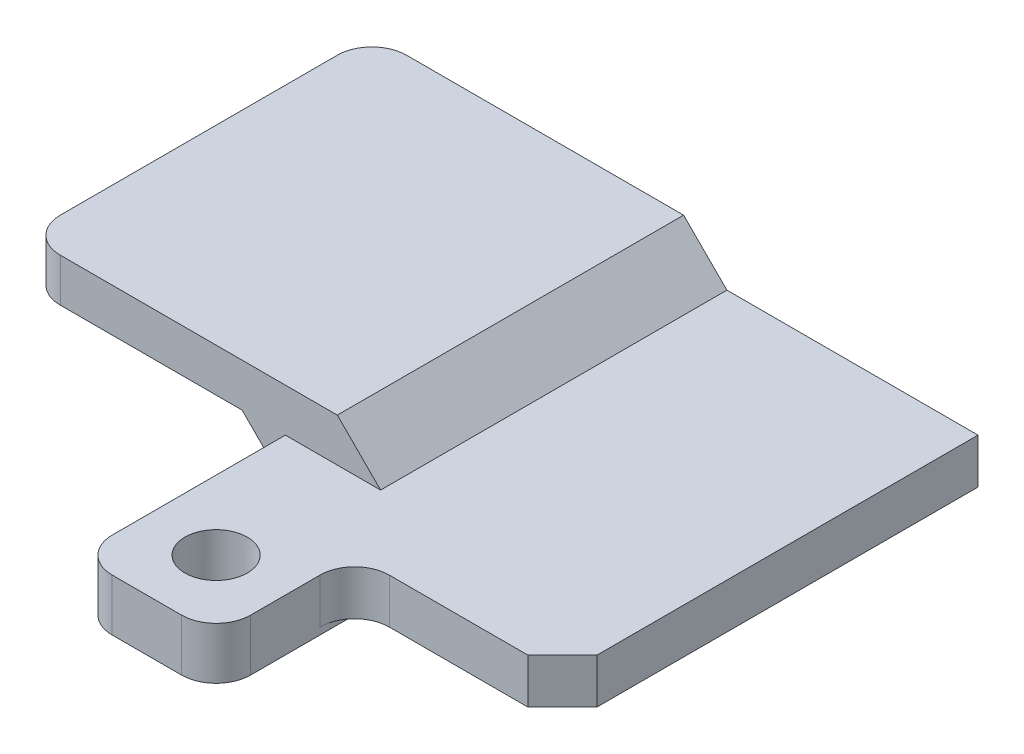
from build123d import *

# Parameters (mm, degrees)
SKETCH1_W           = 20
SKETCH1_H           = 24
BOSS_EXTRUDE1_DEPTH = 3
SKETCH2_W           = 8
SKETCH2_H           = 8
SKETCH2_R           = 1.8
BOSS_EXTRUDE2_DEPTH = 3
FILLET1_R           = 2
CHAMFER1_SIZE       = 2
SKETCH3_W           = 18
SKETCH3_H           = 24
BOSS_EXTRUDE3_DEPTH = 2.5
CHAMFER2_SIZE       = 2.5
CUT_EXTRUDE4_DEPTH  = 4
FILLET2_R           = 2
CUT_EXTRUDE3_DEPTH  = 0.4


with BuildPart() as part:
    # Sketch1 → Boss-Extrude1 (new body)
    with BuildSketch(Plane(origin=(0, 0, 0), x_dir=(1, 0, 0), z_dir=(0, 1, 0))):
        with Locations((10, 12)):
            Rectangle(SKETCH1_W, SKETCH1_H)
    extrude(amount=BOSS_EXTRUDE1_DEPTH)

    # Sketch2 → Boss-Extrude2 (add)
    with BuildSketch(Plane(origin=(0, 3, 0), x_dir=(1, 0, 0), z_dir=(0, 1, 0))):
        with Locations((4, -4)):
            Rectangle(SKETCH2_W, SKETCH2_H)
        with Locations(Location((4, -4, 0), (0, 0, 270))):
            Circle(SKETCH2_R, mode=Mode.SUBTRACT)
    extrude(amount=-BOSS_EXTRUDE2_DEPTH)

    # Fillet1
    fillet1_edges = [part.edges().sort_by_distance(p)[0] for p in [
        (8, 1.5, 0),
        (8, 1.5, 8),
        (0, 1.5, 8),
    ]]
    fillet(fillet1_edges, radius=FILLET1_R)

    # Chamfer1
    chamfer1_edges = [part.edges().sort_by_distance(p)[0] for p in [
        (20, 1.5, 0),
    ]]
    chamfer(chamfer1_edges, length=CHAMFER1_SIZE)

    # Sketch3 → Boss-Extrude3 (add)
    with BuildSketch(Plane(origin=(0, 3, 0), x_dir=(1, 0, 0), z_dir=(0, 1, 0))):
        with Locations((-6, 12)):
            Rectangle(SKETCH3_W, SKETCH3_H)
    extrude(amount=BOSS_EXTRUDE3_DEPTH)

    # Chamfer2
    chamfer2_edges = [part.edges().sort_by_distance(p)[0] for p in [
        (0, 3, -12),
        (3, 3, -12),
    ]]
    chamfer(chamfer2_edges, length=CHAMFER2_SIZE - 0.0001)  # a hair under: the kernel refuses the full size

    # Sketch5 → Cut-Extrude4 (cut)
    with BuildSketch(Plane.XY):
        Polygon((-15, 3), (-2.5, 3), (0, 0.5), (0, 3), (5.5, 3), (3, 5.5), (-15, 5.5), align=None)
    extrude(amount=-CUT_EXTRUDE4_DEPTH, mode=Mode.SUBTRACT)

    # Fillet2
    fillet2_edges = [part.edges().sort_by_distance(p)[0] for p in [
        (-15, 4.25, -24),
        (-15, 4.25, -4),
    ]]
    fillet(fillet2_edges, radius=FILLET2_R)

    # Sketch4 → Cut-Extrude3 (cut)
    with BuildSketch(Plane.XZ):
        Polygon((8, 2), (8, 0), (0, 0), (0, -24), (20, -24), (20, 0), (20, 2), align=None)
    extrude(amount=-CUT_EXTRUDE3_DEPTH, mode=Mode.SUBTRACT)


solid = part.part
